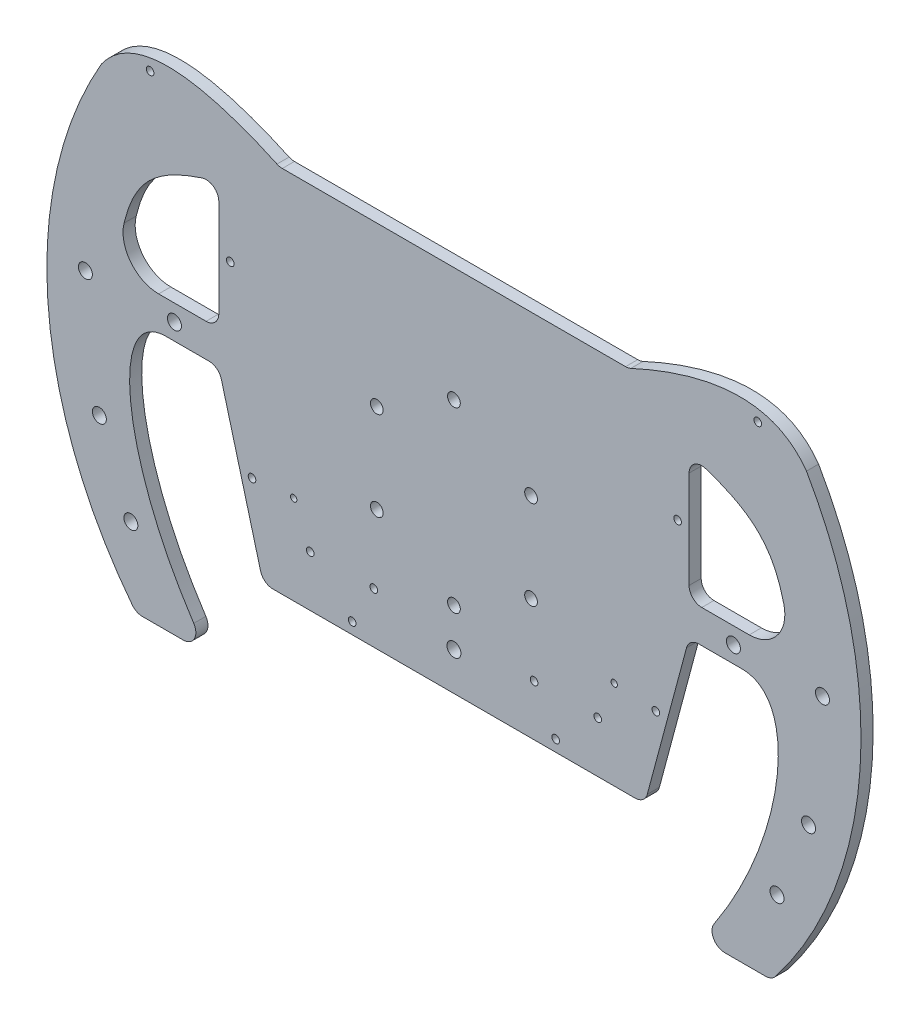
from build123d import *
from OCP.BRepFilletAPI import BRepFilletAPI_MakeFillet

# Parameters (mm, degrees)
BOSS_EXTRUDE1_OUTLINE_R = 2.5
BOSS_EXTRUDE1_DEPTH     = 4.7625
FILLET1_R1              = 5
FILLET1_R2              = 14
SKETCH2_R               = 1.5
CUT_EXTRUDE1_DEPTH      = 189.739718817
SKETCH3_R               = 1.5
CUT_EXTRUDE2_DEPTH      = 189.739718817
SKETCH4_R               = 2.75
SKETCH4_R_2             = 1.25
CUT_EXTRUDE3_DEPTH      = 189.739718817
CUT_EXTRUDE4_REACH      = 190.74
SKETCH5_R               = 2.75


# Read off the part's stored shape, not the designer's step: Boss-Extrude1
with BuildPart() as part:
    # Boss-Extrude1 outline → Boss-Extrude1 (new body)
    with BuildSketch(Plane.XY):
        with BuildLine():
            add(Edge.make_bspline(
                [(96.899959968, -100), (114.213404426, -76.070728811), (130.160127769, -45.855884583), (136.964031048, 0), (113.028861295, 0)],
                knots=[0, 0, 0, 0, 0, 1, 1, 1, 1, 1], degree=4))
            Line((96.899959968, -100), (124.899959968, -100))
            ThreePointArc((124.899959968, -100), (159.540976119, -12.111025509), (138.564064606, 80))
            add(Edge.make_bspline(
                [(138.564064606, 80), (121.144087642, 104.518467408), (68.564064606, 80)],
                knots=[0, 0, 0, 1, 1, 1], degree=2))
            Line((68.564064606, 80), (-68.564064606, 80))
            add(Edge.make_bspline(
                [(-138.564064606, 80), (-121.144087642, 104.518467408), (-68.564064606, 80)],
                knots=[0, 0, 0, 1, 1, 1], degree=2))
            ThreePointArc((-138.564064606, 80), (-159.540976119, -12.111025509), (-124.899959968, -100))
            Line((-124.899959968, -100), (-96.899959968, -100))
            add(Edge.make_bspline(
                [(-96.899959968, -100), (-114.213404426, -76.070728811), (-130.160127769, -45.855884583), (-136.964031048, 0), (-113.028861295, 0)],
                knots=[0, 0, 0, 0, 0, 1, 1, 1, 1, 1], degree=4))
            Line((-113.028861295, 0), (-92.416697508, 0))
            Line((-92.416697508, 0), (-75, -65))
            Line((-75, -65), (75, -65))
            Line((75, -65), (92.416697508, 0))
            Line((92.416697508, 0), (113.028861295, 0))
        make_face()
        with Locations((-30.310889132, -17.5)):
            Circle(BOSS_EXTRUDE1_OUTLINE_R, mode=Mode.SUBTRACT)
        with Locations((0, -35)):
            Circle(BOSS_EXTRUDE1_OUTLINE_R, mode=Mode.SUBTRACT)
        with Locations((30.310889132, -17.5)):
            Circle(BOSS_EXTRUDE1_OUTLINE_R, mode=Mode.SUBTRACT)
        with BuildLine():
            Line((-92.416697508, 13), (-132.416697508, 13))
            add(Edge.make_bspline(
                [(-132.416697508, 13), (-129.068630474, 45.178541959), (-121.847308765, 54.716136669), (-92.416697508, 63)],
                knots=[0, 0, 0, 0, 1, 1, 1, 1], degree=3))
            Line((-92.416697508, 63), (-92.416697508, 13))
        make_face(mode=Mode.SUBTRACT)
        with Locations((-30.310889132, 17.5)):
            Circle(BOSS_EXTRUDE1_OUTLINE_R, mode=Mode.SUBTRACT)
        with Locations((30.310889132, 17.5)):
            Circle(BOSS_EXTRUDE1_OUTLINE_R, mode=Mode.SUBTRACT)
        with Locations((0, 35)):
            Circle(BOSS_EXTRUDE1_OUTLINE_R, mode=Mode.SUBTRACT)
        with BuildLine():
            add(Edge.make_bspline(
                [(132.416697508, 13), (129.068630474, 45.178541959), (121.847308765, 54.716136669), (92.416697508, 63)],
                knots=[0, 0, 0, 0, 1, 1, 1, 1], degree=3))
            Line((132.416697508, 13), (92.416697508, 13))
            Line((92.416697508, 13), (92.416697508, 63))
        make_face(mode=Mode.SUBTRACT)
    extrude(amount=BOSS_EXTRUDE1_DEPTH)

    # Fillet1: one fillet with a radius per group of edges: ONE call of the kernel's fillet builder (fillet() takes one radius for all edges)
    fillet1_edges_1 = [part.edges().sort_by_distance(p)[0] for p in [
        (-92.416697508, 13, 2.38125),
        (-92.416697508, 63, 2.38125),
        (92.416697508, 63, 2.38125),
        (92.416697508, 13, 2.38125),
        (92.416697508, 0, 2.38125),
        (75, -65, 2.38125),
        (-75, -65, 2.38125),
        (-92.416697508, 0, 2.38125),
        (-96.899959968, -100, 2.38125),
        (-124.899959968, -100, 2.38125),
        (-68.564064606, 80, 2.38125),
        (68.564064606, 80, 2.38125),
        (124.899959968, -100, 2.38125),
        (96.899959968, -100, 2.38125),
    ]]
    fillet1_edges_2 = [part.edges().sort_by_distance(p)[0] for p in [
        (-132.416697508, 13, 2.38125),
        (132.416697508, 13, 2.38125),
    ]]
    fillet1 = BRepFilletAPI_MakeFillet(part.part.solid().wrapped)
    for e in fillet1_edges_1:
        fillet1.Add(FILLET1_R1, e.wrapped)
    for e in fillet1_edges_2:
        fillet1.Add(FILLET1_R2, e.wrapped)
    add(Compound.cast(fillet1.Shape()), mode=Mode.REPLACE)

    # Sketch2 → Cut-Extrude1 (cut, symmetric)
    with BuildSketch(Plane(origin=(0, 0, 0), x_dir=(-1, 0, 0), z_dir=(0, 0, -1))):
        with Locations((-119.416619065, 87.181674806)):
            Circle(SKETCH2_R)
        with Locations((-87.916697508, 38)):
            Circle(SKETCH2_R)
        with Locations((-79.361682536, -31.335314297)):
            Circle(SKETCH2_R)
        with Locations((-40, -60.5)):
            Circle(SKETCH2_R)
    cut_extrude1 = extrude(amount=CUT_EXTRUDE1_DEPTH, both=True, mode=Mode.SUBTRACT)

    # Sketch3 → Cut-Extrude2 (cut, through all)
    with BuildSketch(Plane.XY.offset(4.7625)):
        with Locations((31.5, -45)):
            Circle(SKETCH3_R)
        with Locations((56.5, -45)):
            Circle(SKETCH3_R)
    cut_extrude2 = extrude(amount=-CUT_EXTRUDE2_DEPTH, mode=Mode.SUBTRACT)

    # Mirror1: Cut-Extrude1, Cut-Extrude2 across plane
    add(cut_extrude1.mirror(Plane(origin=(0, 0, 0), x_dir=(0, 0, 1), z_dir=(1, 0, 0))), mode=Mode.SUBTRACT)
    add(cut_extrude2.mirror(Plane(origin=(0, 0, 0), x_dir=(0, 0, 1), z_dir=(1, 0, 0))), mode=Mode.SUBTRACT)

    # Sketch4 → Cut-Extrude3 (cut, through all)
    with BuildSketch(Plane.XY.offset(4.7625)):
        with Locations((0, -50)):
            Circle(SKETCH4_R)
        with Locations((-63, -30)):
            Circle(SKETCH4_R_2)
        with Locations((63, -30)):
            Circle(SKETCH4_R_2)
    extrude(amount=-CUT_EXTRUDE3_DEPTH, mode=Mode.SUBTRACT)

    # Sketch5 → Cut-Extrude4 (cut, up to next)
    with BuildSketch(Plane(origin=(0, 0, 0), x_dir=(-1, 0, 0), z_dir=(0, 0, -1)), mode=Mode.PRIVATE) as cut_extrude4_sk1:
        with Locations(Location((109.85423708, 6.5, 0), (0, 0, 180))):
            Circle(SKETCH5_R)
    cut_extrude4_tool1 = extrude(cut_extrude4_sk1.sketch, amount=-CUT_EXTRUDE4_REACH, mode=Mode.PRIVATE) & part.part
    # Sketch5 → Cut-Extrude4 (cut, up to next)
    with BuildSketch(Plane(origin=(0, 0, 0), x_dir=(-1, 0, 0), z_dir=(0, 0, -1)), mode=Mode.PRIVATE) as cut_extrude4_sk2:
        with Locations((-126.984250992, -70)):
            Circle(SKETCH5_R)
    cut_extrude4_tool2 = extrude(cut_extrude4_sk2.sketch, amount=-CUT_EXTRUDE4_REACH, mode=Mode.PRIVATE) & part.part
    # Sketch5 → Cut-Extrude4 (cut, up to next)
    with BuildSketch(Plane(origin=(0, 0, 0), x_dir=(-1, 0, 0), z_dir=(0, 0, -1)), mode=Mode.PRIVATE) as cut_extrude4_sk3:
        with Locations((-144.85423708, 6.5)):
            Circle(SKETCH5_R)
    cut_extrude4_tool3 = extrude(cut_extrude4_sk3.sketch, amount=-CUT_EXTRUDE4_REACH, mode=Mode.PRIVATE) & part.part
    # Sketch5 → Cut-Extrude4 (cut, up to next)
    with BuildSketch(Plane(origin=(0, 0, 0), x_dir=(-1, 0, 0), z_dir=(0, 0, -1)), mode=Mode.PRIVATE) as cut_extrude4_sk4:
        with Locations((-109.85423708, 6.5)):
            Circle(SKETCH5_R)
    cut_extrude4_tool4 = extrude(cut_extrude4_sk4.sketch, amount=-CUT_EXTRUDE4_REACH, mode=Mode.PRIVATE) & part.part
    # Sketch5 → Cut-Extrude4 (cut, up to next)
    with BuildSketch(Plane(origin=(0, 0, 0), x_dir=(-1, 0, 0), z_dir=(0, 0, -1)), mode=Mode.PRIVATE) as cut_extrude4_sk5:
        with Locations((-139.373598648, -40)):
            Circle(SKETCH5_R)
    cut_extrude4_tool5 = extrude(cut_extrude4_sk5.sketch, amount=-CUT_EXTRUDE4_REACH, mode=Mode.PRIVATE) & part.part
    # Sketch5 → Cut-Extrude4 (cut, up to next)
    with BuildSketch(Plane(origin=(0, 0, 0), x_dir=(-1, 0, 0), z_dir=(0, 0, -1)), mode=Mode.PRIVATE) as cut_extrude4_sk6:
        with Locations(Location((144.85423708, 6.5, 0), (0, 0, 180))):
            Circle(SKETCH5_R)
    cut_extrude4_tool6 = extrude(cut_extrude4_sk6.sketch, amount=-CUT_EXTRUDE4_REACH, mode=Mode.PRIVATE) & part.part
    # Sketch5 → Cut-Extrude4 (cut, up to next)
    with BuildSketch(Plane(origin=(0, 0, 0), x_dir=(-1, 0, 0), z_dir=(0, 0, -1)), mode=Mode.PRIVATE) as cut_extrude4_sk7:
        with Locations(Location((139.373598648, -40, 0), (0, 0, 180))):
            Circle(SKETCH5_R)
    cut_extrude4_tool7 = extrude(cut_extrude4_sk7.sketch, amount=-CUT_EXTRUDE4_REACH, mode=Mode.PRIVATE) & part.part
    # Sketch5 → Cut-Extrude4 (cut, up to next)
    with BuildSketch(Plane(origin=(0, 0, 0), x_dir=(-1, 0, 0), z_dir=(0, 0, -1)), mode=Mode.PRIVATE) as cut_extrude4_sk8:
        with Locations(Location((126.984250992, -70, 0), (0, 0, 180))):
            Circle(SKETCH5_R)
    cut_extrude4_tool8 = extrude(cut_extrude4_sk8.sketch, amount=-CUT_EXTRUDE4_REACH, mode=Mode.PRIVATE) & part.part
    add(cut_extrude4_tool1.solids().sort_by_distance((-109.854237, 6.5, 0))[0], mode=Mode.SUBTRACT)
    add(cut_extrude4_tool2.solids().sort_by_distance((126.984251, -70, 0))[0], mode=Mode.SUBTRACT)
    add(cut_extrude4_tool3.solids().sort_by_distance((144.854237, 6.5, 0))[0], mode=Mode.SUBTRACT)
    add(cut_extrude4_tool4.solids().sort_by_distance((109.854237, 6.5, 0))[0], mode=Mode.SUBTRACT)
    add(cut_extrude4_tool5.solids().sort_by_distance((139.373599, -40, 0))[0], mode=Mode.SUBTRACT)
    add(cut_extrude4_tool6.solids().sort_by_distance((-144.854237, 6.5, 0))[0], mode=Mode.SUBTRACT)
    add(cut_extrude4_tool7.solids().sort_by_distance((-139.373599, -40, 0))[0], mode=Mode.SUBTRACT)
    add(cut_extrude4_tool8.solids().sort_by_distance((-126.984251, -70, 0))[0], mode=Mode.SUBTRACT)


solid = part.part
